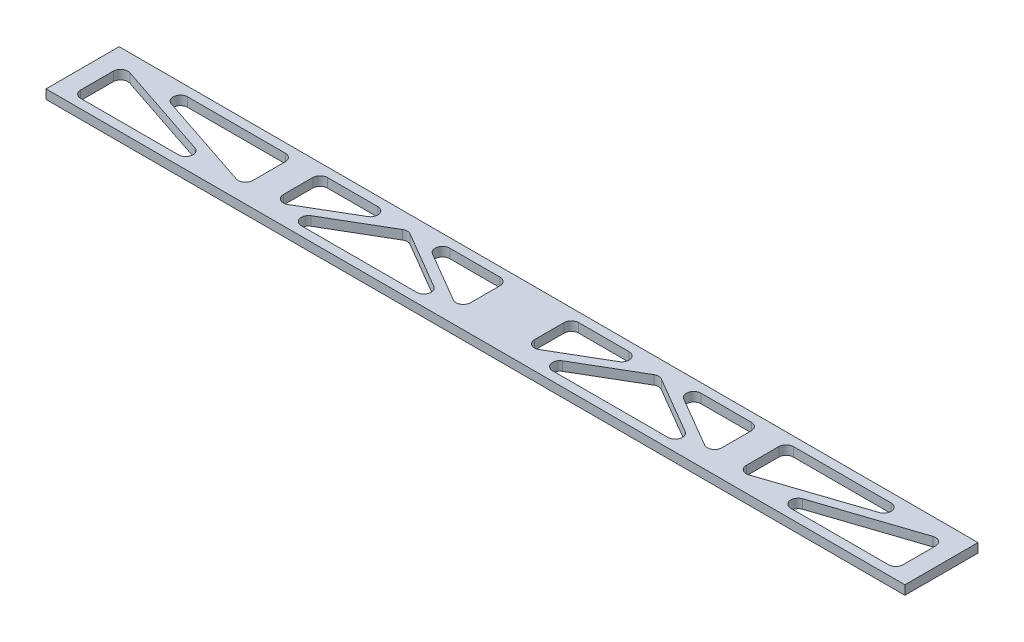
from build123d import *

# Parameters (mm, degrees)
SKETCH1_W           = 298.45
SKETCH1_H           = 25.4
BOSS_EXTRUDE1_DEPTH = 3.175
CUT_EXTRUDE1_DEPTH  = 150.798101623
FILLET1_R           = 2.54


with BuildPart() as part:
    # Sketch1 → Boss-Extrude1 (new body)
    with BuildSketch(Plane(origin=(0, 0, 0), x_dir=(1, 0, 0), z_dir=(0, 1, 0))):
        Rectangle(SKETCH1_W, SKETCH1_H)
    extrude(amount=BOSS_EXTRUDE1_DEPTH)

    # Sketch2 → Cut-Extrude1 (cut, through all)
    with BuildSketch(Plane(origin=(0, 3.175, 0), x_dir=(1, 0, 0), z_dir=(0, 1, 0))):
        Polygon((90.745115786, -9.525), (142.875, -9.525), (142.875, 7.851628071), align=None)
        Polygon((85.725, -7.851628071), (137.854884214, 9.525), (85.725, 9.525), align=None)
        Polygon((76.2, -7.685517516), (76.2, 9.525), (46.798699244, 9.525), align=None)
        Polygon((14.254949244, -9.525), (73.057550756, -9.525), (43.65625, 7.685517516), align=None)
        Polygon((11.1125, -7.685517516), (40.513800756, 9.525), (11.1125, 9.525), align=None)
        Polygon((-11.1125, -7.685517516), (-11.1125, 9.525), (-40.513800756, 9.525), align=None)
        Polygon((-73.057550756, -9.525), (-14.254949244, -9.525), (-43.65625, 7.685517516), align=None)
        Polygon((-76.2, -7.685517516), (-46.798699244, 9.525), (-76.2, 9.525), align=None)
        Polygon((-85.725, -7.851628071), (-85.725, 9.525), (-137.854884214, 9.525), align=None)
        Polygon((-142.875, -9.525), (-90.745115786, -9.525), (-142.875, 7.851628071), align=None)
    extrude(amount=-CUT_EXTRUDE1_DEPTH, mode=Mode.SUBTRACT)

    # Fillet1
    fillet1_edges = [part.edges().sort_by_distance(p)[0] for p in [
        (-14.254949244, 1.5875, 9.525),
        (-73.057550756, 1.5875, 9.525),
        (-43.65625, 1.5875, -7.685517516),
        (-11.1125, 1.5875, 7.685517516),
        (-40.513800756, 1.5875, -9.525),
        (-11.1125, 1.5875, -9.525),
        (-46.798699244, 1.5875, -9.525),
        (-76.2, 1.5875, 7.685517516),
        (-76.2, 1.5875, -9.525),
        (73.057550756, 1.5875, 9.525),
        (14.254949244, 1.5875, 9.525),
        (43.65625, 1.5875, -7.685517516),
        (142.875, 1.5875, -7.851628071),
        (142.875, 1.5875, 9.525),
        (90.745115786, 1.5875, 9.525),
        (40.513800756, 1.5875, -9.525),
        (11.1125, 1.5875, 7.685517516),
        (11.1125, 1.5875, -9.525),
        (76.2, 1.5875, 7.685517516),
        (46.798699244, 1.5875, -9.525),
        (76.2, 1.5875, -9.525),
        (137.854884214, 1.5875, -9.525),
        (85.725, 1.5875, 7.851628071),
        (85.725, 1.5875, -9.525),
        (-137.854884214, 1.5875, -9.525),
        (-85.725, 1.5875, 7.851628071),
        (-85.725, 1.5875, -9.525),
        (-90.745115786, 1.5875, 9.525),
        (-142.875, 1.5875, 9.525),
        (-142.875, 1.5875, -7.851628071),
    ]]
    fillet(fillet1_edges, radius=FILLET1_R)


solid = part.part
